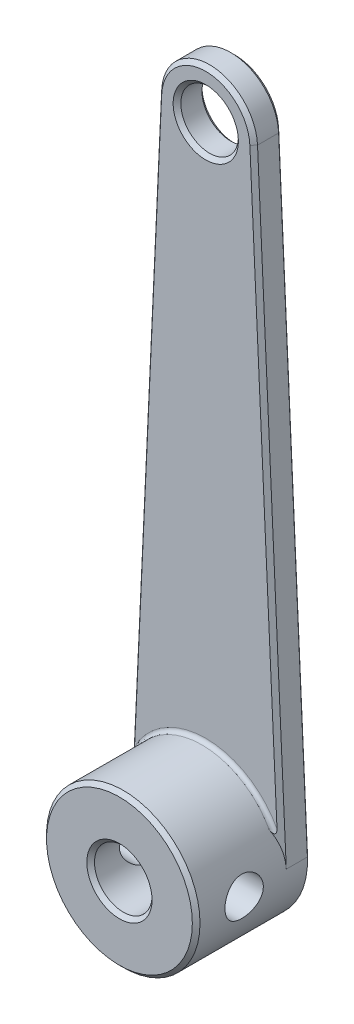
from build123d import *

# Parameters (mm, degrees)
SKETCH1_R               = 4
SKETCH1_R_2             = 1.5
BOSS_EXTRUDE1_DEPTH     = 6
SKETCH2_R               = 1.5000000000000004
BOSS_EXTRUDE2_DEPTH     = 1.5
CUT_EXTRUDE1_DEPTH      = 36.245567097154215
CUT_EXTRUDE1_DEPTH_BACK = 36.245567097154215
SKETCH3_R               = 1.0000000000000002
CHAMFER1_SIZE           = 0.2
FILLET1_R               = 0.2


with BuildPart() as part:
    # Sketch1 → Boss-Extrude1 (new body)
    with BuildSketch(Plane.XY):
        Circle(SKETCH1_R)
        Circle(SKETCH1_R_2, mode=Mode.SUBTRACT)
    extrude(amount=BOSS_EXTRUDE1_DEPTH)

    # Sketch2 → Boss-Extrude2 (add)
    with BuildSketch(Plane.XY):
        with BuildLine():
            Line((-3.995603052106154, 0.18750000000000017), (-2.4972519075663464, 32.1171875))
            ThreePointArc((-2.4972519075663464, 32.1171875), (1.5e-16, 34.5), (2.4972519075663464, 32.1171875))
            Line((2.4972519075663464, 32.1171875), (3.995603052106154, 0.18750000000000017))
            ThreePointArc((3.995603052106154, 0.18750000000000017), (2.4e-16, 4.000000000000002), (-3.995603052106154, 0.18750000000000017))
        make_face()
        with Locations((0, 32)):
            Circle(SKETCH2_R, mode=Mode.SUBTRACT)
    extrude(amount=BOSS_EXTRUDE2_DEPTH)

    # Sketch3 → Cut-Extrude1 (cut, two sides: drawn at the far end of the back side and taken through both)
    with BuildSketch(Plane(origin=(0, 0, 0), x_dir=(0, 0, -1), z_dir=(1, 0, 0)).offset(-CUT_EXTRUDE1_DEPTH_BACK)):
        with Locations((-3.5, 0)):
            Circle(SKETCH3_R)
    extrude(amount=CUT_EXTRUDE1_DEPTH + CUT_EXTRUDE1_DEPTH_BACK, mode=Mode.SUBTRACT)

    # Chamfer1
    # the kernel refuses this chamfer: 0.2 mm, written as the material it takes off along each edge
    with BuildSketch(Plane(origin=(0, 0, 0), x_dir=(-0.9989007630265381, 0.04687500000000028, 0), z_dir=(0.04687500000000028, 0.9989007630265381, 0))) as chamfer1_piece_1:
        Polygon((4, CHAMFER1_SIZE), (4 - CHAMFER1_SIZE, 0), (4, 0), align=None)
    revolve(axis=Axis((0, 0, 0), (0, 0, 1)), revolution_arc=182.68672418569162, mode=Mode.SUBTRACT)
    with BuildSketch(Plane(origin=(2.4972519075663464, 32.1171875, 1.5), x_dir=(0.027465652126399, 0.0012888692161212708, -0.9996219169112966), z_dir=(0.04687500000000002, -0.9989007630265381, 0))) as chamfer1_piece_2_section:
        Polygon((CHAMFER1_SIZE * 0.999621916911, -CHAMFER1_SIZE * 0.0274958766106), (-CHAMFER1_SIZE * 0.0274958766106, -CHAMFER1_SIZE * 0.999621916911), (0, 0), align=None)
    chamfer1_piece_2 = extrude(amount=32.4791610144424, mode=Mode.PRIVATE)
    chamfer1_piece_2 = chamfer1_piece_2 - Plane(origin=(0, 0, 1.4336940433446623), x_dir=(1, 0, 0), z_dir=(0, 0, -1)) * Cylinder(4, 66, mode=Mode.PRIVATE)
    add(chamfer1_piece_2, mode=Mode.SUBTRACT)
    with BuildSketch(Plane(origin=(1.1e-16, 32, 1.5), x_dir=(-0.9989007630265381, 0.04687499999999997, 0), z_dir=(-0.04687499999999997, -0.9989007630265381, 0))) as chamfer1_piece_3:
        Polygon((2.5000000000000013 - CHAMFER1_SIZE, 0), (2.5000000000000013, CHAMFER1_SIZE), (2.5000000000000013, 0), align=None)
    revolve(axis=Axis((1.1e-16, 32, 1.5), (0, 0, -1)), revolution_arc=174.62655162861682, mode=Mode.SUBTRACT)
    with BuildSketch(Plane(origin=(-4.019712580118334, -0.32627121978830154, 1.5), x_dir=(0.9985230955407449, -0.046857277355217046, 0.027495876610586282), z_dir=(0.04687500000000002, 0.9989007630265381, 0))) as chamfer1_piece_4_section:
        Polygon((CHAMFER1_SIZE * 0.999621916911, CHAMFER1_SIZE * 0.0274958766106), (-CHAMFER1_SIZE * 0.0274958766106, CHAMFER1_SIZE * 0.999621916911), (0, 0), align=None)
    chamfer1_piece_4 = extrude(amount=32.479161014442404, mode=Mode.PRIVATE)
    chamfer1_piece_4 = chamfer1_piece_4 - Plane(origin=(0, 0, 1.433694043044513), x_dir=(1, 0, 0), z_dir=(0, 0, -1)) * Cylinder(4, 66, mode=Mode.PRIVATE)
    add(chamfer1_piece_4, mode=Mode.SUBTRACT)
    with BuildSketch(Plane(origin=(0, 32, 0), x_dir=(1, 0, 0), z_dir=(0, -1, 0))) as chamfer1_piece_5:
        Polygon((1.5000000000000004 + CHAMFER1_SIZE, 0), (1.5000000000000004, CHAMFER1_SIZE), (1.5000000000000004, 0), align=None)
    revolve(axis=Axis((0, 32, 0), (0, 0, 1)), mode=Mode.SUBTRACT)
    with BuildSketch(Plane(origin=(2.4972519075663464, 32.1171875, 0), x_dir=(-0.9985230955407451, -0.04685727735521706, -0.02749587661058638), z_dir=(0.04687500000000002, -0.9989007630265381, 0))) as chamfer1_piece_6:
        Polygon((CHAMFER1_SIZE * 0.999621916911, -CHAMFER1_SIZE * 0.0274958766106), (-CHAMFER1_SIZE * 0.0274958766106, -CHAMFER1_SIZE * 0.999621916911), (0, 0), align=None)
    extrude(amount=31.96482441684922, mode=Mode.SUBTRACT)
    with BuildSketch(Plane(origin=(1.1e-16, 32, 0), x_dir=(-0.9989007630265381, 0.04687499999999997, 0), z_dir=(-0.04687499999999997, -0.9989007630265381, 0))) as chamfer1_piece_7:
        Polygon((2.5000000000000013 - CHAMFER1_SIZE, 0), (2.5000000000000013, -CHAMFER1_SIZE), (2.5000000000000013, 0), align=None)
    revolve(axis=Axis((1.1e-16, 32, 0), (0, 0, -1)), revolution_arc=174.62655162861682, mode=Mode.SUBTRACT)
    with BuildSketch(Plane(origin=(-3.995603052106154, 0.18750000000000017, 0), x_dir=(0.9985230955407449, -0.04685727735521705, -0.027495876610586376), z_dir=(0.04687500000000002, 0.9989007630265381, 0))) as chamfer1_piece_8:
        Polygon((CHAMFER1_SIZE * 0.999621916911, -CHAMFER1_SIZE * 0.0274958766106), (-CHAMFER1_SIZE * 0.0274958766106, -CHAMFER1_SIZE * 0.999621916911), (0, 0), align=None)
    extrude(amount=31.96482441684922, mode=Mode.SUBTRACT)
    with BuildSketch(Plane(origin=(0, 32, 1.5), x_dir=(1, 0, 0), z_dir=(0, -1, 0))) as chamfer1_piece_9:
        Polygon((1.5000000000000004 + CHAMFER1_SIZE, 0), (1.5000000000000004, -CHAMFER1_SIZE), (1.5000000000000004, 0), align=None)
    revolve(axis=Axis((0, 32, 1.5), (0, 0, 1)), mode=Mode.SUBTRACT)
    with BuildSketch(Plane(origin=(0, 0, 6), x_dir=(1, 0, 0), z_dir=(0, -1, 0))) as chamfer1_piece_10:
        Polygon((4, -CHAMFER1_SIZE), (4 - CHAMFER1_SIZE, 0), (4, 0), align=None)
    revolve(axis=Axis((0, 0, 6), (0, 0, 1)), mode=Mode.SUBTRACT)
    with BuildSketch(Plane(origin=(0, 0, 6), x_dir=(1, 0, 0), z_dir=(0, -1, 0))) as chamfer1_piece_11:
        Polygon((1.5 + CHAMFER1_SIZE, 0), (1.5, -CHAMFER1_SIZE), (1.5, 0), align=None)
    revolve(axis=Axis((0, 0, 6), (0, 0, 1)), mode=Mode.SUBTRACT)
    with BuildSketch(Plane(origin=(0, 0, 0), x_dir=(1, 0, 0), z_dir=(0, -1, 0))) as chamfer1_piece_12:
        Polygon((4, CHAMFER1_SIZE), (4 - CHAMFER1_SIZE, 0), (4, 0), align=None)
    revolve(axis=Axis((0, 0, 0), (0, 0, 1)), revolution_arc=2.686724185691597, mode=Mode.SUBTRACT)

    # Fillet1
    fillet1_edges = [part.edges().sort_by_distance(p)[0] for p in [
        (-1.15197e-12, 4.000000000000002, 1.5),
    ]]
    fillet(fillet1_edges, radius=FILLET1_R)


solid = part.part
